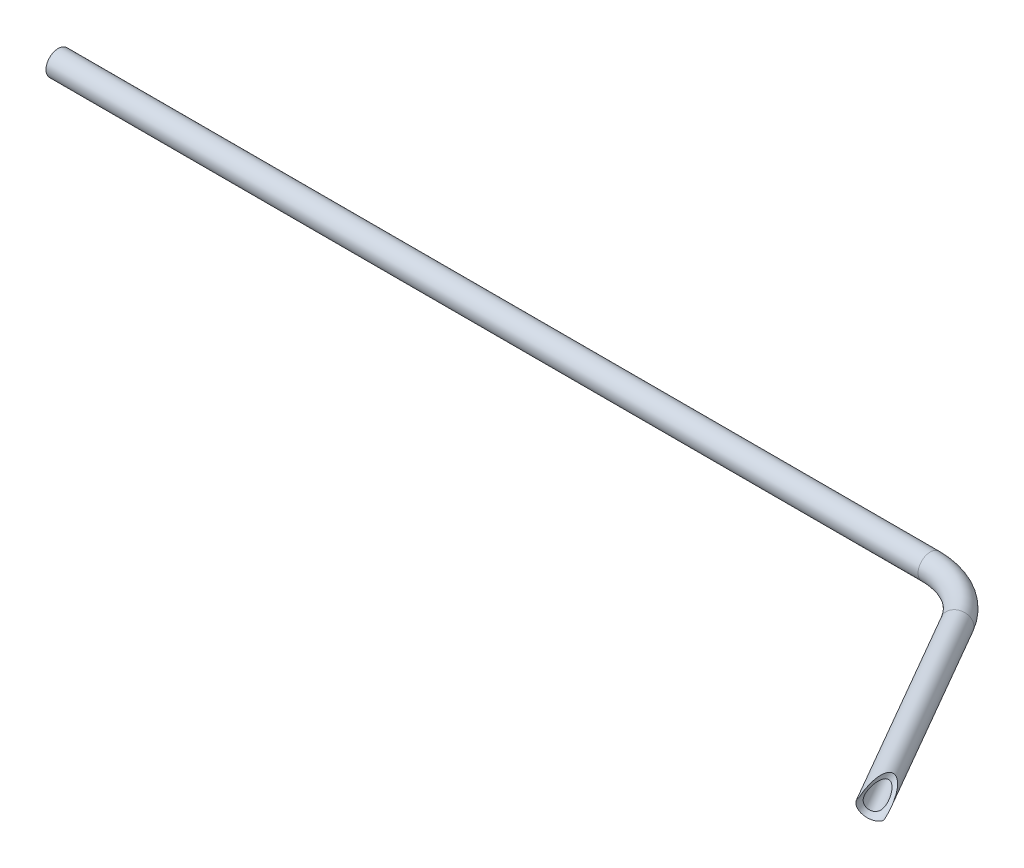
from build123d import *

# Parameters (mm, degrees)
SKETCH2_R               = 50
SKETCH2_R_2             = 35
CUT_EXTRUDE1_DEPTH      = 4422.603745
CUT_EXTRUDE1_DEPTH_BACK = 4422.603745
SKETCH5_R               = 50


with BuildPart() as part:
    # Sweep1: sweep along a path in Sketch1
    with BuildLine(Plane(origin=(0, 0, 0), x_dir=(1, 0, 0), z_dir=(0, 1, 0))) as sweep1_path:
        Line((0, 0), (3561.782625, 0))
        ThreePointArc((3561.782625, 0), (3711.782625, -40.192379), (3821.590246, -150))
        Line((3821.590246, -150), (4300, -978.63))
    # Sketch2 → Sweep1 (sweep)
    with BuildSketch(Plane(origin=(0, 0, 0), x_dir=(0, 0, -1), z_dir=(1, 0, 0))):
        Circle(SKETCH2_R)
        Circle(SKETCH2_R_2, mode=Mode.SUBTRACT)
    sweep(path=sweep1_path.line)

    # Sketch5 → Cut-Extrude1 (cut, two sides: drawn at the far end of the back side and taken through both)
    with BuildSketch(Plane(origin=(4300, 0, 978.63), x_dir=(1, 0, 0), z_dir=(0, 0.4955907748587309, -0.8685561489477366)).offset(-CUT_EXTRUDE1_DEPTH_BACK)):
        Circle(SKETCH5_R)
    extrude(amount=CUT_EXTRUDE1_DEPTH + CUT_EXTRUDE1_DEPTH_BACK, mode=Mode.SUBTRACT)


solid = part.part
